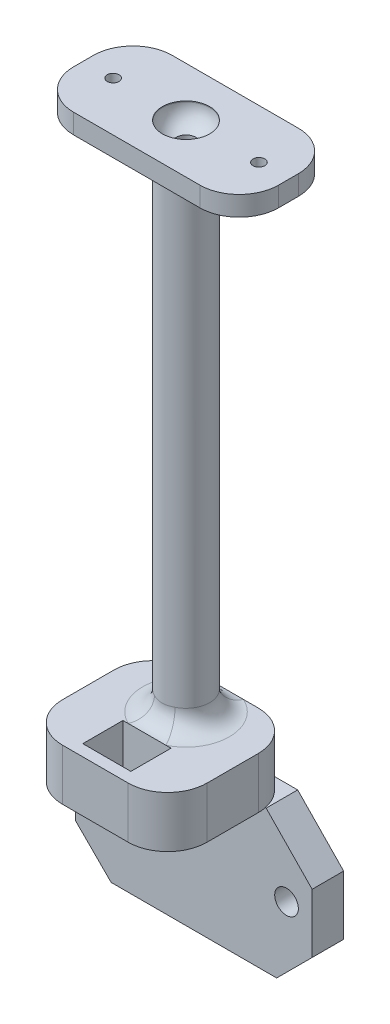
from build123d import *

# Parameters (mm, degrees)
SKETCH_1_W           = 52
SKETCH_1_H           = 25
SKETCH_1_R           = 1.5
EXTRUDE_1_DEPTH      = 5
SKETCH_2_R           = 4
SKETCH_2_R_2         = 2.5
EXTRUDE_2_DEPTH      = 125
FILLET_1_R           = 10
SKETCH_2_3_R         = 6
SKETCH_2_3_R_2       = 4
EXTRUDE_4_DEPTH      = 125
FILLET_3_R           = 5
CUT_EXTRUDE_START    = -50
SKETCH_2_4_R         = 6
CUT_EXTRUDE_1_DEPTH  = 50
FILLET_4_R           = 5
EXTRUDE_5_DEPTH      = 23
EXTRUDE_5_DEPTH_BACK = 10
SKETCH_3_W           = 36.659715442
SKETCH_3_H           = 13
SKETCH_4_W           = 12.2
SKETCH_4_H           = 10.2
CUT_EXTRUDE_2_DEPTH  = 16
FILLET_5_R           = 10
EXTRUDE_6_DEPTH      = 8
FILLET_9_R           = 5
SKETCH_10_W          = 42
SKETCH_10_H          = 8
EXTRUDE_7_DEPTH      = 3
SKETCH_8_R           = 3
CUT_EXTRUDE_5_DEPTH  = 179.328348954


with BuildPart() as part:
    # 草图1 → 凸台-拉伸1 (new body)
    with BuildSketch(Plane(origin=(0, 0, 0), x_dir=(1, 0, 0), z_dir=(0, 1, 0))):
        Rectangle(SKETCH_1_W, SKETCH_1_H)
        with Locations(Location((-18.5, 0, 0), (0, 0, 270))):
            Circle(SKETCH_1_R, mode=Mode.SUBTRACT)
        with Locations(Location((18.5, 0, 0), (0, 0, 270))):
            Circle(SKETCH_1_R, mode=Mode.SUBTRACT)
    extrude(amount=EXTRUDE_1_DEPTH)

    # 草图2 → 凸台-拉伸2 (add)
    with BuildSketch(Plane.XZ):
        with Locations(Location((0, 0, 0), (0, 0, 90))):
            Circle(SKETCH_2_R)
        with Locations(Location((0, 0, 0), (0, 0, 270))):
            Circle(SKETCH_2_R_2, mode=Mode.SUBTRACT)
    extrude(amount=EXTRUDE_2_DEPTH)

    # 圆角1
    fillet_1_edges = [part.edges().sort_by_distance(p)[0] for p in [
        (26, 2.5, 12.5),
        (-26, 2.5, 12.5),
        (-26, 2.5, -12.5),
        (26, 2.5, -12.5),
    ]]
    fillet(fillet_1_edges, radius=FILLET_1_R)

    # 草图2<3> → 凸台-拉伸4 (add)
    with BuildSketch(Plane.XZ):
        with Locations(Location((0, 0, 0), (0, 0, 90))):
            Circle(SKETCH_2_3_R)
        Circle(SKETCH_2_3_R_2, mode=Mode.SUBTRACT)
    extrude(amount=EXTRUDE_4_DEPTH)

    # 圆角3
    fillet_3_edges = [part.edges().sort_by_distance(p)[0] for p in [
        (0, 0, -6),
    ]]
    fillet(fillet_3_edges, radius=FILLET_3_R)

    # 草图2<4> → 切除-拉伸1 (cut)
    with BuildSketch(Plane.XZ.offset(CUT_EXTRUDE_START)):
        with Locations(Location((0, 0, 0), (0, 0, 90))):
            Circle(SKETCH_2_4_R)
    extrude(amount=CUT_EXTRUDE_1_DEPTH, mode=Mode.SUBTRACT)

    # 圆角4
    # the kernel refuses this fillet: 5 mm, written as the material it adds along each edge
    with BuildSketch(Plane(origin=(0, 0, 0), x_dir=(0, 0, 1), z_dir=(1, 0, 0))) as fillet_4_piece_1:
        with BuildLine():
            CenterArc((1, -4.769696007), FILLET_4_R, 0, 72.542396876)
            Line((2.5, 0), (2.53, 0.09539392))
            ThreePointArc((2.53, 0.09539392), (4.25, 0.1), (6, 0.1))
            Line((6, 0.1), (6.1, 0))
            Line((6.1, 0), (6.1, -4.769696007))
            Line((6.1, -4.769696007), (6, -4.769696007))
        make_face()
    revolve(axis=Axis((0, 0, 0), (0, -1, 0)))

    # 草图3 → 凸台-拉伸5 (add, two sides: drawn at the far end of the back side and taken through both)
    with BuildSketch(Plane.XY.offset(-EXTRUDE_5_DEPTH_BACK)):
        with Locations((0, -131.5)):
            Rectangle(SKETCH_3_W, SKETCH_3_H)
    extrude(amount=EXTRUDE_5_DEPTH + EXTRUDE_5_DEPTH_BACK)

    # 草图4 → 切除-拉伸2 (cut)
    with BuildSketch(Plane(origin=(0, -125, 0), x_dir=(1, 0, 0), z_dir=(0, 1, 0))):
        with Locations((0, -15)):
            Rectangle(SKETCH_4_W, SKETCH_4_H)
    extrude(amount=-CUT_EXTRUDE_2_DEPTH, mode=Mode.SUBTRACT)

    # 圆角5
    fillet_5_edges = [part.edges().sort_by_distance(p)[0] for p in [
        (18.329857721, -131.5, -10),
        (-18.329857721, -131.5, -10),
        (18.329857721, -131.5, 23),
        (-18.329857721, -131.5, 23),
    ]]
    fillet(fillet_5_edges, radius=FILLET_5_R)

    # 草图5 → 凸台-拉伸6 (add)
    with BuildSketch(Plane.XY.offset(-10)):
        Polygon((-18.329857721, -138), (-30, -150), (-30, -165), (-21, -174), (0, -174), (21, -174), (30, -165), (30, -150), (18.329857721, -138), align=None)
    extrude(amount=EXTRUDE_6_DEPTH)

    # 圆角9
    fillet_9_edges = [part.edges().sort_by_distance(p)[0] for p in [
        (0, -125, -6),
    ]]
    fillet(fillet_9_edges, radius=FILLET_9_R)

    # 草图10 → 凸台-拉伸7 (add)
    with BuildSketch(Plane.XZ.offset(174)):
        with Locations((0, -6)):
            Rectangle(SKETCH_10_W, SKETCH_10_H)
    extrude(amount=-EXTRUDE_7_DEPTH)

    # 草图8 → 切除-拉伸5 (cut, through all)
    with BuildSketch(Plane.XY.offset(-2)):
        with Locations((23.5, -156)):
            Circle(SKETCH_8_R)
        with Locations((-23.5, -156)):
            Circle(SKETCH_8_R)
    extrude(amount=-CUT_EXTRUDE_5_DEPTH, mode=Mode.SUBTRACT)


solid = part.part
